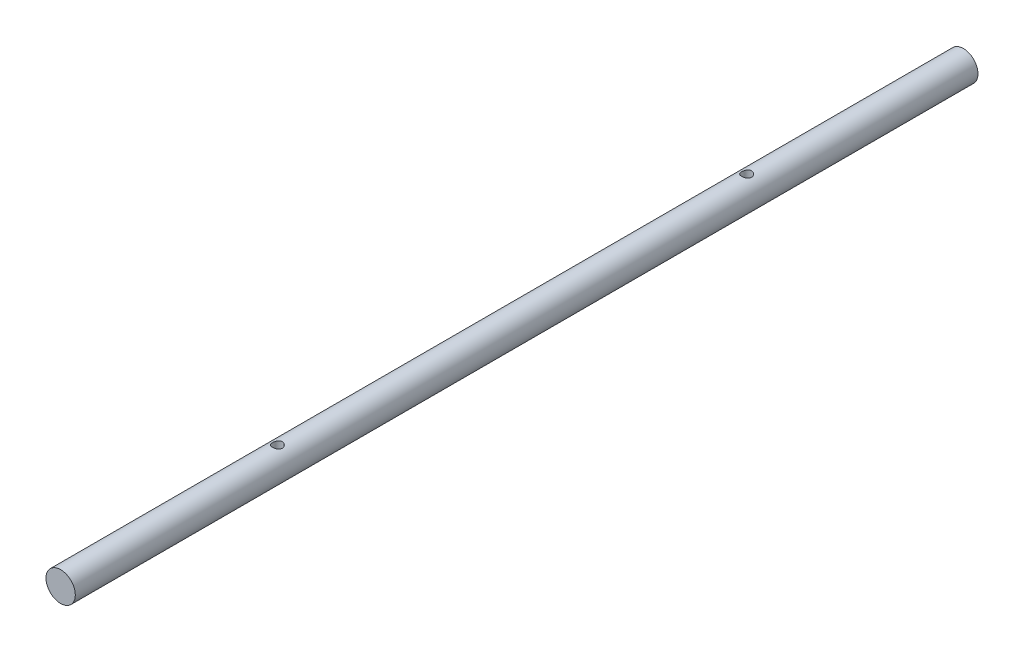
from build123d import *

# Parameters (mm, degrees)
SKETCH1_R           = 9.525
BOSS_EXTRUDE1_DEPTH = 586.105
CUT_EXTRUDE2_REACH  = 588.492
SKETCH3_R           = 3.175
CUT_EXTRUDE3_DEPTH  = 2.38125


with BuildPart() as part:
    # Sketch1 → Boss-Extrude1 (new body)
    with BuildSketch(Plane.XY):
        Circle(SKETCH1_R)
    extrude(amount=BOSS_EXTRUDE1_DEPTH)

    # Sketch3 → Cut-Extrude2 (cut, up to next)
    with BuildSketch(Plane(origin=(0, -9.525, 0), x_dir=(1, 0, 0), z_dir=(0, 1, 0)), mode=Mode.PRIVATE) as cut_extrude2_sk1:
        with Locations((0, -445.389)):
            Circle(SKETCH3_R)
    cut_extrude2_tool1 = extrude(cut_extrude2_sk1.sketch, amount=CUT_EXTRUDE2_REACH, mode=Mode.PRIVATE) & part.part
    # Sketch3 → Cut-Extrude2 (cut, up to next)
    with BuildSketch(Plane(origin=(0, -9.525, 0), x_dir=(1, 0, 0), z_dir=(0, 1, 0)), mode=Mode.PRIVATE) as cut_extrude2_sk2:
        with Locations((0, -140.716)):
            Circle(SKETCH3_R)
    cut_extrude2_tool2 = extrude(cut_extrude2_sk2.sketch, amount=CUT_EXTRUDE2_REACH, mode=Mode.PRIVATE) & part.part
    add(cut_extrude2_tool1.solids().sort_by_distance((0, -9.525, 445.389))[0], mode=Mode.SUBTRACT)
    add(cut_extrude2_tool2.solids().sort_by_distance((0, -9.525, 140.716))[0], mode=Mode.SUBTRACT)

    # Sketch5 → Cut-Extrude3 (cut)
    with BuildSketch(Plane(origin=(0, -9.525, 0), x_dir=(1, 0, 0), z_dir=(0, 1, 0))):
        with BuildLine():
            Line((-2.38125, -178.816), (-2.38125, -159.766))
            ThreePointArc((-2.38125, -159.766), (0, -157.38475), (2.38125, -159.766))
            Line((2.38125, -159.766), (2.38125, -178.816))
            ThreePointArc((2.38125, -178.816), (0, -181.19725), (-2.38125, -178.816))
        make_face()
        with BuildLine():
            Line((2.38125, -407.289), (2.38125, -426.339))
            ThreePointArc((2.38125, -426.339), (0, -428.72025), (-2.38125, -426.339))
            Line((-2.38125, -426.339), (-2.38125, -407.289))
            ThreePointArc((-2.38125, -407.289), (0, -404.90775), (2.38125, -407.289))
        make_face()
    extrude(amount=CUT_EXTRUDE3_DEPTH, mode=Mode.SUBTRACT)


solid = part.part
